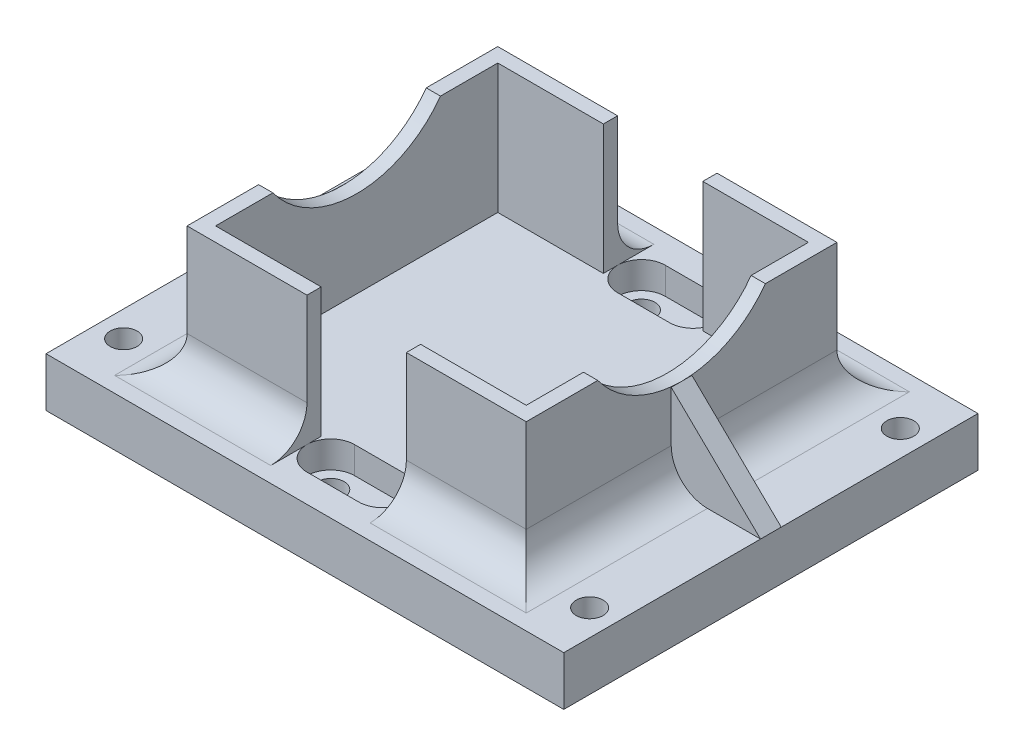
from build123d import *

# Parameters (mm, degrees)
SKETCH_1_W           = 100
SKETCH_1_H           = 80
SKETCH_1_R           = 2.6
EXTRUDE_1_DEPTH      = 9.5
CUT_EXTRUDE_1_DEPTH  = 5.2
EXTRUDE_2_DEPTH      = 25
FILLET_1_R           = 7
SKETCH_7_R           = 20
CUT_EXTRUDE_2_DEPTH  = 99.172361182
EXTRUDE_3_DEPTH      = 2
EXTRUDE_3_DEPTH_BACK = 2


with BuildPart() as part:
    # 草图1 → 凸台-拉伸1 (new body)
    with BuildSketch(Plane(origin=(0, 0, 0), x_dir=(1, 0, 0), z_dir=(0, 1, 0))):
        Rectangle(SKETCH_1_W, SKETCH_1_H)
        with Locations(Location((-45, 30, 0), (0, 0, 270))):
            Circle(SKETCH_1_R, mode=Mode.SUBTRACT)
        with Locations(Location((-5, 30, 0), (0, 0, 270))):
            Circle(SKETCH_1_R, mode=Mode.SUBTRACT)
        with Locations(Location((-5, -30, 0), (0, 0, 270))):
            Circle(SKETCH_1_R, mode=Mode.SUBTRACT)
        with Locations(Location((-45, -30, 0), (0, 0, 270))):
            Circle(SKETCH_1_R, mode=Mode.SUBTRACT)
        with Locations(Location((45, -30, 0), (0, 0, 90))):
            Circle(SKETCH_1_R, mode=Mode.SUBTRACT)
        with Locations(Location((5, -30, 0), (0, 0, 90))):
            Circle(SKETCH_1_R, mode=Mode.SUBTRACT)
        with Locations(Location((5, 30, 0), (0, 0, 90))):
            Circle(SKETCH_1_R, mode=Mode.SUBTRACT)
        with Locations(Location((45, 30, 0), (0, 0, 90))):
            Circle(SKETCH_1_R, mode=Mode.SUBTRACT)
    extrude(amount=EXTRUDE_1_DEPTH)

    # 草图4 → 切除-拉伸1 (cut)
    with BuildSketch(Plane(origin=(0, 9.5, 0), x_dir=(1, 0, 0), z_dir=(0, 1, 0))):
        with BuildLine():
            Line((-5, 34.6), (5, 34.6))
            ThreePointArc((5, 34.6), (9.6, 30), (5, 25.4))
            Line((5, 25.4), (-5, 25.4))
            ThreePointArc((-5, 25.4), (-9.6, 30), (-5, 34.6))
        make_face()
        with BuildLine():
            Line((-5, -25.4), (5, -25.4))
            ThreePointArc((5, -25.4), (9.6, -30), (5, -34.6))
            Line((5, -34.6), (-5, -34.6))
            ThreePointArc((-5, -34.6), (-9.6, -30), (-5, -25.4))
        make_face()
    extrude(amount=-CUT_EXTRUDE_1_DEPTH, mode=Mode.SUBTRACT)

    # 草图5 → 凸台-拉伸2 (add)
    with BuildSketch(Plane(origin=(0, 9.5, 0), x_dir=(1, 0, 0), z_dir=(0, 1, 0))):
        Polygon((-9.6, 27.25), (-9.6, 29.999521433), (-32.75, 29.999521433), (-32.75, -29.999521433), (-9.6, -29.999521433), (-9.6, -27.25), (-30, -27.25), (-30, 27.25), align=None)
        Polygon((32.75, 29.999521433), (9.6, 29.999521433), (9.6, 27.25), (30, 27.25), (30, -27.25), (9.6, -27.25), (9.6, -29.999521433), (32.75, -29.999521433), align=None)
    extrude(amount=EXTRUDE_2_DEPTH)

    # 圆角1
    # the kernel refuses this fillet: 7 mm, written as the material it adds along each edge
    with BuildSketch(Plane(origin=(32.75, 9.5, 29.999521433), x_dir=(1, 0, 0), z_dir=(0, 0, -1)), Plane(origin=(-32.75, 9.5, -29.999521433), x_dir=(-1, 0, 0), z_dir=(0, 0, 1))) as fillet_1_piece_1:
        with BuildLine():
            CenterArc((FILLET_1_R, -FILLET_1_R), FILLET_1_R, 90, 90)
            Line((0, -FILLET_1_R), (-FILLET_1_R * 0.02, -FILLET_1_R))
            Line((-FILLET_1_R * 0.02, -FILLET_1_R), (-FILLET_1_R * 0.02, FILLET_1_R * 0.02))
            Line((-FILLET_1_R * 0.02, FILLET_1_R * 0.02), (FILLET_1_R, FILLET_1_R * 0.02))
            Line((FILLET_1_R, FILLET_1_R * 0.02), (FILLET_1_R, 0))
        make_face()
    extrude(amount=59.999042867)
    with BuildSketch(Plane(origin=(32.75, 9.5, -29.999521433), x_dir=(0, 0, -1), z_dir=(-1, 0, 0)), Plane(origin=(9.6, 9.5, 29.999521433), x_dir=(0, 0, 1), z_dir=(1, 0, 0)), Plane(origin=(-9.6, 9.5, -29.999521433), x_dir=(0, 0, -1), z_dir=(-1, 0, 0)), Plane(origin=(-32.75, 9.5, 29.999521433), x_dir=(0, 0, 1), z_dir=(1, 0, 0))) as fillet_1_piece_2:
        with BuildLine():
            CenterArc((FILLET_1_R, -FILLET_1_R), FILLET_1_R, 90, 90)
            Line((0, -FILLET_1_R), (-FILLET_1_R * 0.02, -FILLET_1_R))
            Line((-FILLET_1_R * 0.02, -FILLET_1_R), (-FILLET_1_R * 0.02, FILLET_1_R * 0.02))
            Line((-FILLET_1_R * 0.02, FILLET_1_R * 0.02), (FILLET_1_R, FILLET_1_R * 0.02))
            Line((FILLET_1_R, FILLET_1_R * 0.02), (FILLET_1_R, 0))
        make_face()
    extrude(amount=23.15)
    with BuildSketch(Plane(origin=(9.6, 9.5, 29.999521433), x_dir=(0, 0, 1), z_dir=(1, 0, 0))) as fillet_1_piece_3a_section:
        with BuildLine():
            CenterArc((FILLET_1_R, -FILLET_1_R), FILLET_1_R, 90, 90)
            Line((0, -FILLET_1_R), (-FILLET_1_R * 0.02, -FILLET_1_R))
            Line((-FILLET_1_R * 0.02, -FILLET_1_R), (-FILLET_1_R * 0.02, FILLET_1_R * 0.02))
            Line((-FILLET_1_R * 0.02, FILLET_1_R * 0.02), (FILLET_1_R, FILLET_1_R * 0.02))
            Line((FILLET_1_R, FILLET_1_R * 0.02), (FILLET_1_R, 0))
        make_face()
    fillet_1_piece_3a = extrude(amount=40.65, mode=Mode.PRIVATE)
    fillet_1_piece_3a = split(fillet_1_piece_3a, bisect_by=Plane(origin=(32.75, 11.0847658, 31.584287233), z_dir=(1, 0, 0)), keep=Keep.TOP, mode=Mode.PRIVATE)
    with BuildSketch(Plane(origin=(32.75, 9.5, 47.499521433), x_dir=(1, 0, 0), z_dir=(0, 0, -1))) as fillet_1_piece_3b_section:
        with BuildLine():
            CenterArc((FILLET_1_R, -FILLET_1_R), FILLET_1_R, 90, 90)
            Line((0, -FILLET_1_R), (-FILLET_1_R * 0.02, -FILLET_1_R))
            Line((-FILLET_1_R * 0.02, -FILLET_1_R), (-FILLET_1_R * 0.02, FILLET_1_R * 0.02))
            Line((-FILLET_1_R * 0.02, FILLET_1_R * 0.02), (FILLET_1_R, FILLET_1_R * 0.02))
            Line((FILLET_1_R, FILLET_1_R * 0.02), (FILLET_1_R, 0))
        make_face()
    fillet_1_piece_3b = extrude(amount=77.499042867, mode=Mode.PRIVATE)
    fillet_1_piece_3b = split(fillet_1_piece_3b, bisect_by=Plane(origin=(34.3347658, 11.0847658, 29.999521433), z_dir=(0, 0, 1)), keep=Keep.TOP, mode=Mode.PRIVATE)
    fillet_1_piece_3 = fillet_1_piece_3a & fillet_1_piece_3b
    add(fillet_1_piece_3)
    with BuildSketch(Plane(origin=(32.75, 9.5, 29.999521433), x_dir=(1, 0, 0), z_dir=(0, 0, -1))) as fillet_1_piece_4a_section:
        with BuildLine():
            CenterArc((FILLET_1_R, -FILLET_1_R), FILLET_1_R, 90, 90)
            Line((0, -FILLET_1_R), (-FILLET_1_R * 0.02, -FILLET_1_R))
            Line((-FILLET_1_R * 0.02, -FILLET_1_R), (-FILLET_1_R * 0.02, FILLET_1_R * 0.02))
            Line((-FILLET_1_R * 0.02, FILLET_1_R * 0.02), (FILLET_1_R, FILLET_1_R * 0.02))
            Line((FILLET_1_R, FILLET_1_R * 0.02), (FILLET_1_R, 0))
        make_face()
    fillet_1_piece_4a = extrude(amount=77.499042867, mode=Mode.PRIVATE)
    fillet_1_piece_4a = split(fillet_1_piece_4a, bisect_by=Plane(origin=(34.3347658, 11.0847658, -29.999521433), z_dir=(0, 0, -1)), keep=Keep.TOP, mode=Mode.PRIVATE)
    with BuildSketch(Plane(origin=(50.25, 9.5, -29.999521433), x_dir=(0, 0, -1), z_dir=(-1, 0, 0))) as fillet_1_piece_4b_section:
        with BuildLine():
            CenterArc((FILLET_1_R, -FILLET_1_R), FILLET_1_R, 90, 90)
            Line((0, -FILLET_1_R), (-FILLET_1_R * 0.02, -FILLET_1_R))
            Line((-FILLET_1_R * 0.02, -FILLET_1_R), (-FILLET_1_R * 0.02, FILLET_1_R * 0.02))
            Line((-FILLET_1_R * 0.02, FILLET_1_R * 0.02), (FILLET_1_R, FILLET_1_R * 0.02))
            Line((FILLET_1_R, FILLET_1_R * 0.02), (FILLET_1_R, 0))
        make_face()
    fillet_1_piece_4b = extrude(amount=40.65, mode=Mode.PRIVATE)
    fillet_1_piece_4b = split(fillet_1_piece_4b, bisect_by=Plane(origin=(32.75, 11.0847658, -31.584287233), z_dir=(1, 0, 0)), keep=Keep.TOP, mode=Mode.PRIVATE)
    fillet_1_piece_4 = fillet_1_piece_4a & fillet_1_piece_4b
    add(fillet_1_piece_4)
    with BuildSketch(Plane(origin=(-9.6, 9.5, -29.999521433), x_dir=(0, 0, -1), z_dir=(-1, 0, 0))) as fillet_1_piece_5a_section:
        with BuildLine():
            CenterArc((FILLET_1_R, -FILLET_1_R), FILLET_1_R, 90, 90)
            Line((0, -FILLET_1_R), (-FILLET_1_R * 0.02, -FILLET_1_R))
            Line((-FILLET_1_R * 0.02, -FILLET_1_R), (-FILLET_1_R * 0.02, FILLET_1_R * 0.02))
            Line((-FILLET_1_R * 0.02, FILLET_1_R * 0.02), (FILLET_1_R, FILLET_1_R * 0.02))
            Line((FILLET_1_R, FILLET_1_R * 0.02), (FILLET_1_R, 0))
        make_face()
    fillet_1_piece_5a = extrude(amount=40.65, mode=Mode.PRIVATE)
    fillet_1_piece_5a = split(fillet_1_piece_5a, bisect_by=Plane(origin=(-32.75, 11.0847658, -31.584287233), z_dir=(-1, 0, 0)), keep=Keep.TOP, mode=Mode.PRIVATE)
    with BuildSketch(Plane(origin=(-32.75, 9.5, -47.499521433), x_dir=(-1, 0, 0), z_dir=(0, 0, 1))) as fillet_1_piece_5b_section:
        with BuildLine():
            CenterArc((FILLET_1_R, -FILLET_1_R), FILLET_1_R, 90, 90)
            Line((0, -FILLET_1_R), (-FILLET_1_R * 0.02, -FILLET_1_R))
            Line((-FILLET_1_R * 0.02, -FILLET_1_R), (-FILLET_1_R * 0.02, FILLET_1_R * 0.02))
            Line((-FILLET_1_R * 0.02, FILLET_1_R * 0.02), (FILLET_1_R, FILLET_1_R * 0.02))
            Line((FILLET_1_R, FILLET_1_R * 0.02), (FILLET_1_R, 0))
        make_face()
    fillet_1_piece_5b = extrude(amount=77.499042867, mode=Mode.PRIVATE)
    fillet_1_piece_5b = split(fillet_1_piece_5b, bisect_by=Plane(origin=(-34.3347658, 11.0847658, -29.999521433), z_dir=(0, 0, -1)), keep=Keep.TOP, mode=Mode.PRIVATE)
    fillet_1_piece_5 = fillet_1_piece_5a & fillet_1_piece_5b
    add(fillet_1_piece_5)
    with BuildSketch(Plane(origin=(-32.75, 9.5, -29.999521433), x_dir=(-1, 0, 0), z_dir=(0, 0, 1))) as fillet_1_piece_6a_section:
        with BuildLine():
            CenterArc((FILLET_1_R, -FILLET_1_R), FILLET_1_R, 90, 90)
            Line((0, -FILLET_1_R), (-FILLET_1_R * 0.02, -FILLET_1_R))
            Line((-FILLET_1_R * 0.02, -FILLET_1_R), (-FILLET_1_R * 0.02, FILLET_1_R * 0.02))
            Line((-FILLET_1_R * 0.02, FILLET_1_R * 0.02), (FILLET_1_R, FILLET_1_R * 0.02))
            Line((FILLET_1_R, FILLET_1_R * 0.02), (FILLET_1_R, 0))
        make_face()
    fillet_1_piece_6a = extrude(amount=77.499042867, mode=Mode.PRIVATE)
    fillet_1_piece_6a = split(fillet_1_piece_6a, bisect_by=Plane(origin=(-34.3347658, 11.0847658, 29.999521433), z_dir=(0, 0, 1)), keep=Keep.TOP, mode=Mode.PRIVATE)
    with BuildSketch(Plane(origin=(-50.25, 9.5, 29.999521433), x_dir=(0, 0, 1), z_dir=(1, 0, 0))) as fillet_1_piece_6b_section:
        with BuildLine():
            CenterArc((FILLET_1_R, -FILLET_1_R), FILLET_1_R, 90, 90)
            Line((0, -FILLET_1_R), (-FILLET_1_R * 0.02, -FILLET_1_R))
            Line((-FILLET_1_R * 0.02, -FILLET_1_R), (-FILLET_1_R * 0.02, FILLET_1_R * 0.02))
            Line((-FILLET_1_R * 0.02, FILLET_1_R * 0.02), (FILLET_1_R, FILLET_1_R * 0.02))
            Line((FILLET_1_R, FILLET_1_R * 0.02), (FILLET_1_R, 0))
        make_face()
    fillet_1_piece_6b = extrude(amount=40.65, mode=Mode.PRIVATE)
    fillet_1_piece_6b = split(fillet_1_piece_6b, bisect_by=Plane(origin=(-32.75, 11.0847658, 31.584287233), z_dir=(-1, 0, 0)), keep=Keep.TOP, mode=Mode.PRIVATE)
    fillet_1_piece_6 = fillet_1_piece_6a & fillet_1_piece_6b
    add(fillet_1_piece_6)

    # 草图7 → 切除-拉伸2 (cut, through all)
    with BuildSketch(Plane.ZY.offset(32.75)):
        with Locations((0, 46.25)):
            Circle(SKETCH_7_R)
    extrude(amount=-CUT_EXTRUDE_2_DEPTH, mode=Mode.SUBTRACT)

    # 草图6 → 凸台-拉伸3 (add, two sides: drawn at the far end of the back side and taken through both)
    with BuildSketch(Plane.XY.offset(-EXTRUDE_3_DEPTH_BACK)):
        Polygon((-32.75, 26.25), (-50, 9.5), (-32.75, 9.5), align=None)
        Polygon((32.75, 9.5), (32.75, 26.25), (50, 9.5), align=None)
    extrude(amount=EXTRUDE_3_DEPTH + EXTRUDE_3_DEPTH_BACK)


solid = part.part
